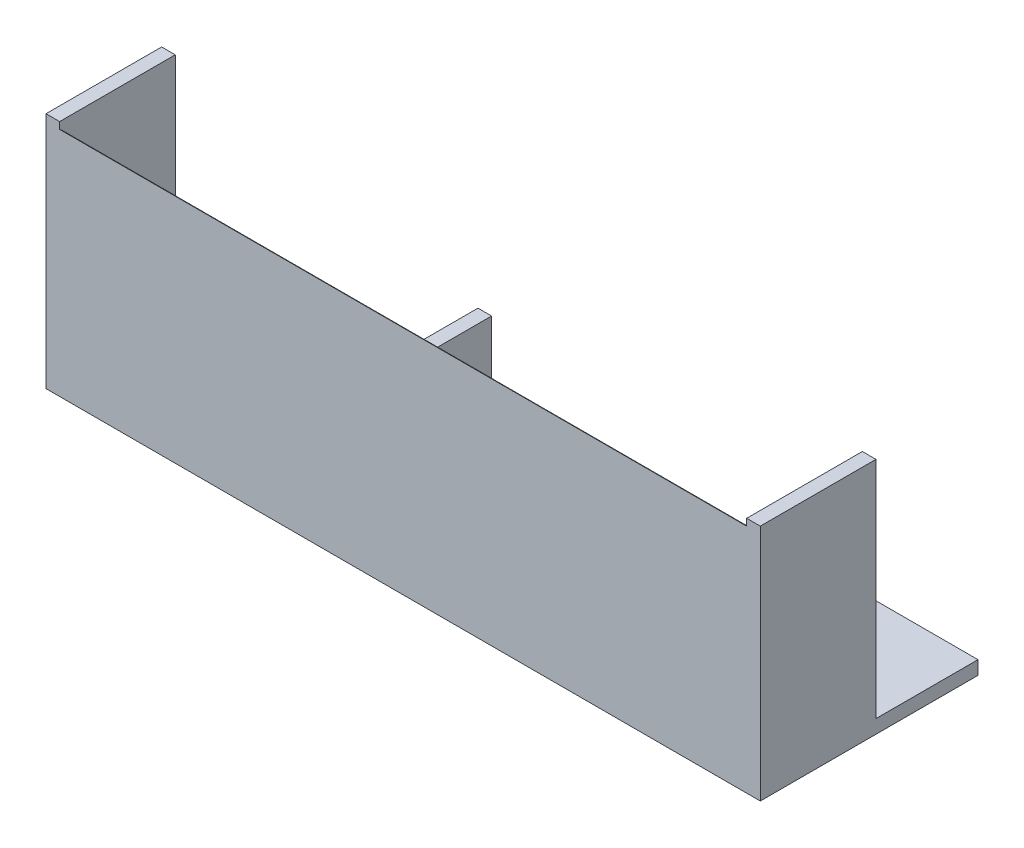
from build123d import *

# Parameters (mm, degrees)
SKETCH1_W           = 210
SKETCH1_H           = 70
BOSS_EXTRUDE1_DEPTH = 4
SKETCH2_W           = 210
SKETCH2_H           = 4
BOSS_EXTRUDE2_DEPTH = 60
SKETCH3_W           = 4
SKETCH3_H           = 66
BOSS_EXTRUDE3_DEPTH = 30
FILLET1_R           = 10
SKETCH5_W           = 4
SKETCH5_H           = 56
BOSS_EXTRUDE4_DEPTH = 20


with BuildPart() as part:
    # Sketch1 → Boss-Extrude1 (new body)
    with BuildSketch(Plane.XY):
        with Locations((-9.965753425, 84.434931507)):
            Rectangle(SKETCH1_W, SKETCH1_H)
    extrude(amount=BOSS_EXTRUDE1_DEPTH)

    # Sketch2 → Boss-Extrude2 (add)
    with BuildSketch(Plane.XY):
        with Locations((-9.965753425, 51.434931507)):
            Rectangle(SKETCH2_W, SKETCH2_H)
    extrude(amount=-BOSS_EXTRUDE2_DEPTH)

    # Sketch3 → Boss-Extrude3 (add)
    with BuildSketch(Plane.XY):
        with Locations((-112.965753425, 86.434931507)):
            Rectangle(SKETCH3_W, SKETCH3_H)
        with Locations((93.034246575, 86.434931507)):
            Rectangle(SKETCH3_W, SKETCH3_H)
    extrude(amount=-BOSS_EXTRUDE3_DEPTH)

    # Fillet1
    # the kernel refuses this fillet: 10 mm, written as the material it takes off along each edge
    with BuildSketch(Plane(origin=(-110.965753425, 119.434931507, 0), x_dir=(0, 0, 1), z_dir=(1, 0, 0))) as fillet1_piece_1:
        with BuildLine():
            CenterArc((FILLET1_R, FILLET1_R), FILLET1_R, 180, 90)
            Line((0, FILLET1_R), (0, 0))
            Line((0, 0), (FILLET1_R, 0))
        make_face()
    extrude(amount=202, mode=Mode.SUBTRACT)

    # Sketch5 → Boss-Extrude4 (add)
    with BuildSketch(Plane(origin=(0, 0, 0), x_dir=(-1, 0, 0), z_dir=(0, 0, -1))):
        with Locations((9.965753425, 81.434931507)):
            Rectangle(SKETCH5_W, SKETCH5_H)
    extrude(amount=BOSS_EXTRUDE4_DEPTH)


solid = part.part
